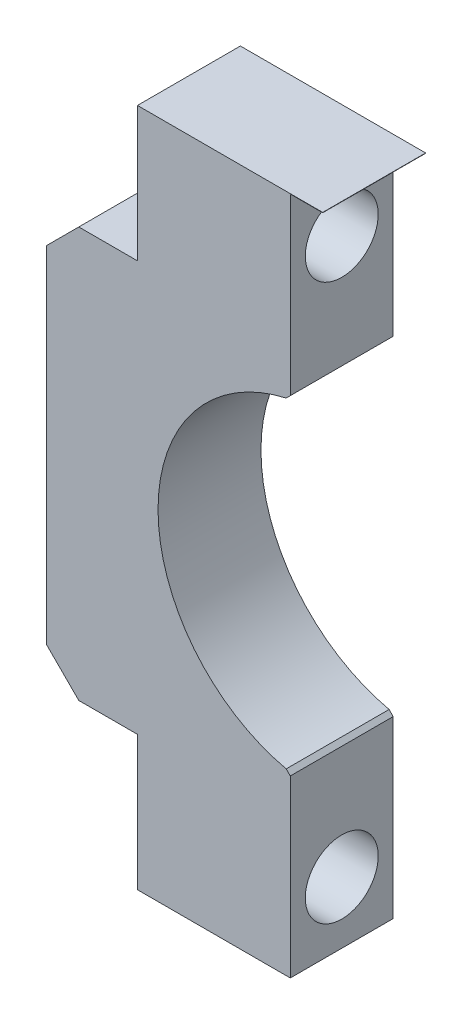
from build123d import *

# Parameters (mm, degrees)
BOSS_EXTRUDE2_DEPTH  = 3.175
CHAMFER2_SIZE        = 2
M4_CLEARANCE_HOLE1_D = 4.5
CHAMFER1_SIZE        = 2
SKETCH6_W            = 2
SKETCH6_H            = 41.891167458
CUT_EXTRUDE1_DEPTH   = 28.75134276


with BuildPart() as part:
    # Sketch1 → Boss-Extrude2 (new, symmetric)
    with BuildSketch(Plane.XY):
        with BuildLine():
            Line((0, 10.16), (0, 20.955))
            Line((0, 20.955), (-11.43, 20.955))
            Line((-11.43, 20.955), (-11.43, 12.651387276))
            Line((-11.43, 12.651387276), (-17.05, 12.651387276))
            Line((-17.05, 12.651387276), (-17.05, -12.651387276))
            Line((-17.05, -12.651387276), (-11.43, -12.651387276))
            Line((-11.43, -12.651387276), (-11.43, -20.955))
            Line((-11.43, -20.955), (0, -20.955))
            Line((0, -20.955), (0, -10.16))
            ThreePointArc((0, -10.16), (-10.16, 0), (0, 10.16))
        make_face()
    extrude(amount=BOSS_EXTRUDE2_DEPTH, both=True)

    # Chamfer2
    chamfer2_edges = [part.edges().sort_by_distance(p)[0] for p in [
        (-17.05, -12.651387276, 0),
        (-17.05, 12.651387276, 0),
    ]]
    chamfer(chamfer2_edges, length=CHAMFER2_SIZE)

    # M4 Clearance Hole1 (through all)
    with Locations(Plane.ZY.offset(17.05)):
        with Locations((0, 17.145), (0, -17.145)):
            Hole(M4_CLEARANCE_HOLE1_D / 2)

    # Chamfer1
    # the kernel refuses this chamfer: 2 mm, written as the material it takes off along each edge
    with BuildSketch(Plane(origin=(0, -10.16, 9.000384751), x_dir=(-0.9937566306409056, 0.1115695256655456, 0), z_dir=(0, 0, -1))) as chamfer1_piece_1:
        with BuildLine():
            Line((2.267092762, 0), (-CHAMFER1_SIZE * 0.111569525666, -CHAMFER1_SIZE * 0.993756630641))
            Line((-CHAMFER1_SIZE * 0.111569525666, -CHAMFER1_SIZE * 0.993756630641), (0, 0))
            ThreePointArc((0, 0), (1.165083929, -0.063383685), (2.267092762, 0))
        make_face()
    extrude(amount=18.000769503, mode=Mode.SUBTRACT)
    with BuildSketch(Plane(origin=(0, 10.16, 9.000384751), x_dir=(0, 1, 0), z_dir=(0, 0, -1))) as chamfer1_piece_2:
        with BuildLine():
            Line((CHAMFER1_SIZE, 0), (-0.252938464, -2.252938464))
            ThreePointArc((-0.252938464, -2.252938464), (-0.066999904, -1.164881567), (0, 0))
            Line((0, 0), (CHAMFER1_SIZE, 0))
        make_face()
    extrude(amount=18.000769503, mode=Mode.SUBTRACT)

    # Sketch6 → Cut-Extrude1 (cut, through all)
    with BuildSketch(Plane.XY.offset(3.175)):
        with Locations((-1, -0.009416271)):
            Rectangle(SKETCH6_W, SKETCH6_H)
    extrude(amount=-CUT_EXTRUDE1_DEPTH, mode=Mode.SUBTRACT)


solid = part.part
